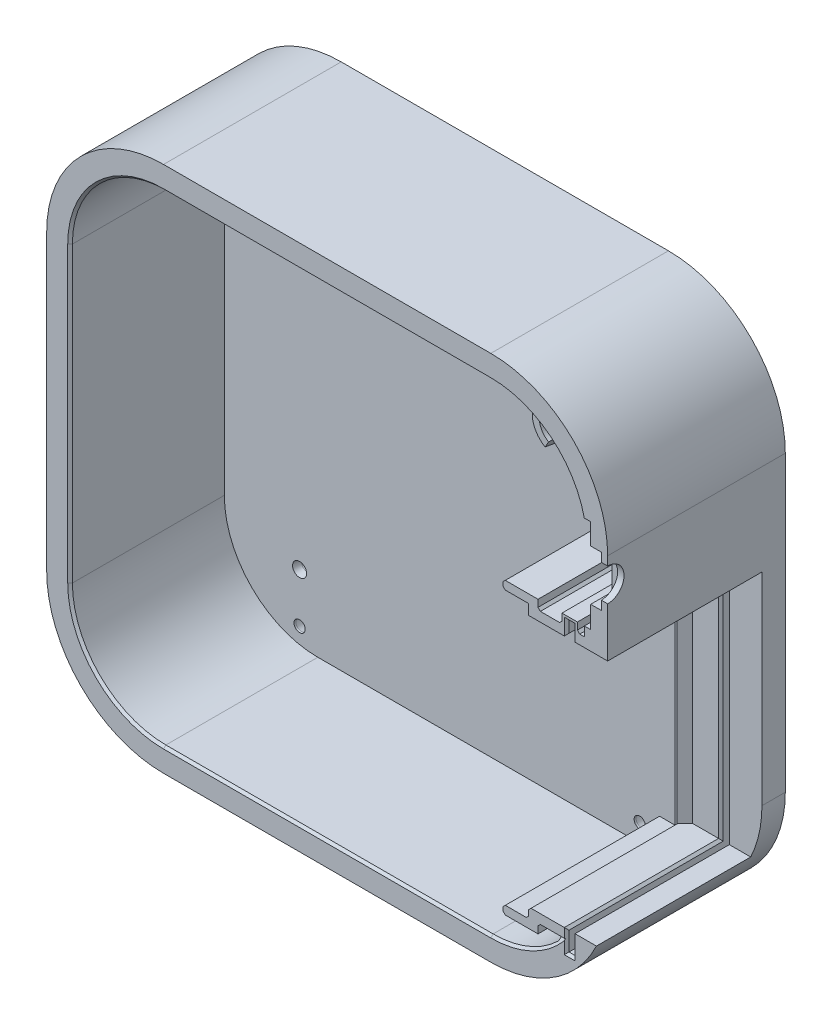
from build123d import *
from build123d.topology import SkipClean

# Parameters (mm, degrees)
SKETCH1_W                = 120
SKETCH1_H                = 120
BOSS_EXTRUDE1_DEPTH      = 5
SKETCH4_W                = 120
SKETCH4_H                = 120
SKETCH4_W_2              = 98.1
SKETCH4_H_2              = 97.5
CUT_EXTRUDE1_DEPTH       = 86
SKETCH9_R                = 1.2
CUT_EXTRUDE2_DEPTH       = 75.102968901
CUT_EXTRUDE4_DEPTH       = 3
SKETCH17_R               = 1.5
SKETCH16_R               = 1.2
SKETCH17_3_R             = 1.5
SKETCH16_3_R             = 1.2
MOVE_FACE2_BY            = 5
MOVE_FACE2_2_BY          = 5
MOVE_FACE3_BY            = 5
MOVE_FACE3_2_BY          = 5
MOVE_FACE4_BY            = 11.9
MOVE_FACE5_BY            = 5.3
FILLET1_R                = 25
SKETCH20_R               = 3
CUT_EXTRUDE5_DEPTH       = 3
CUT_EXTRUDE6_REACH       = 95.2
SKETCH21_R               = 1.2
SKETCH22_R               = 1.5
SKETCH23_R               = 1.2
SKETCH22_3_R             = 1.5
SKETCH23_3_R             = 1.2
SKETCH22_4_R             = 1.5
SKETCH23_4_R             = 1.2
SKETCH22_5_R             = 1.5
SKETCH23_5_R             = 1.2
BOSS_EXTRUDE2_DEPTH      = 33
CUT_EXTRUDE7_REACH       = 100.824
SKETCH31_W               = 9.9
SKETCH31_H               = 2
BOSS_EXTRUDE3_DEPTH      = 33
CUT_EXTRUDE8_REACH       = 100.824
SKETCH35_R               = 5.75
BOSS_EXTRUDE4_START      = 22
BOSS_EXTRUDE4_DEPTH      = 22
SKETCH40_R               = 5.5
SKETCH39_R               = 7.25
SKETCH41_R               = 4
CUT_EXTRUDE9_DEPTH       = 4.5
SKETCH42_R               = 5.75
SKETCH38_R               = 4
CUT_EXTRUDE10_DEPTH      = 4.5
CUT_EXTRUDE11_DEPTH      = 99.824339107
BOSS_EXTRUDE5_REACH      = 105.207
SKETCH49_W               = 11.8
SKETCH49_H               = 10.8
CUT_EXTRUDE12_DEPTH      = 4.6
SKETCH50_R               = 3.5
CUT_EXTRUDE13_DEPTH      = 1.366443
CUT_EXTRUDE14_DEPTH      = 33
CUT_EXTRUDE14_DEPTH_BACK = 2.62
SKETCH51_W               = 1.3
SKETCH51_H               = 61.54
BOSS_EXTRUDE6_DEPTH      = 33
CHAMFER1_SIZE            = 0.5
CHAMFER1_SIZE_2          = 0.353553391
FILLET2_R                = 1


with BuildPart() as part:
    # Sketch1 → Boss-Extrude1 (new body)
    with BuildSketch(Plane.XY):
        Rectangle(SKETCH1_W, SKETCH1_H)
    extrude(amount=BOSS_EXTRUDE1_DEPTH)

    # Sketch4 → Cut-Extrude1 (cut, through all)
    with BuildSketch(Plane.XY.offset(5)):
        Rectangle(SKETCH4_W, SKETCH4_H)
        with Locations((1.45, -5.25)):
            Rectangle(SKETCH4_W_2, SKETCH4_H_2, mode=Mode.SUBTRACT)
    extrude(amount=-CUT_EXTRUDE1_DEPTH, mode=Mode.SUBTRACT)

    # Sketch9 → Cut-Extrude2 (cut, through all)
    with BuildSketch(Plane.XY.offset(5)):
        with Locations((26, 39)):
            Circle(SKETCH9_R)
        with Locations((-31.5, -45)):
            Circle(SKETCH9_R)
    extrude(amount=-CUT_EXTRUDE2_DEPTH, mode=Mode.SUBTRACT)

    # Sketch14 → Cut-Extrude4 (cut)
    with BuildSketch(Plane(origin=(0, 0, 0), x_dir=(-1, 0, 0), z_dir=(0, 0, -1))):
        Polygon((33.1, -47.771281292), (34.7, -45), (33.1, -42.228718708), (29.9, -42.228718708), (28.3, -45), (29.9, -47.771281292), align=None)
        Polygon((-24.4, 36.228718708), (-22.8, 39), (-24.4, 41.771281292), (-27.6, 41.771281292), (-29.2, 39), (-27.6, 36.228718708), align=None)
    extrude(amount=-CUT_EXTRUDE4_DEPTH, mode=Mode.SUBTRACT)

    # Sketch17 → Cut-Loft3 section 0
    with BuildSketch(Plane.XY.offset(5)):
        with Locations((-31.5, -45)):
            Circle(SKETCH17_R)
    # Sketch16 → Cut-Loft3 section 1
    with BuildSketch(Plane.XY.offset(3.4)):
        with Locations((-31.5, -45)):
            Circle(SKETCH16_R)
    loft(mode=Mode.SUBTRACT)

    # Sketch17<3> → Cut-Loft4 section 0
    with BuildSketch(Plane.XY.offset(5)):
        with Locations((26, 39)):
            Circle(SKETCH17_3_R)
    # Sketch16<3> → Cut-Loft4 section 1
    with BuildSketch(Plane.XY.offset(3.4)):
        with Locations((26, 39)):
            Circle(SKETCH16_3_R)
    loft(mode=Mode.SUBTRACT)

    # Move Face2: a face moved outward by 5.0
    extrude(part.faces().sort_by_distance((1.45, -54, 2.5))[0], amount=MOVE_FACE2_BY, dir=(0, -1, 0))

    # Move Face2 2: a face moved outward by 5.0
    extrude(part.faces().sort_by_distance((1.45, 43.5, 2.5))[0], amount=MOVE_FACE2_2_BY, dir=(0, 1, 0))

    # Move Face3: a face moved outward by 5.0
    extrude(part.faces().sort_by_distance((-47.6, -5.25, 2.5))[0], amount=MOVE_FACE3_BY, dir=(-1, 0, 0))

    # Move Face3 2: a face moved outward by 5.0
    extrude(part.faces().sort_by_distance((50.5, -5.25, 2.5))[0], amount=MOVE_FACE3_2_BY, dir=(1, 0, 0))

    # Move Face4: a face moved outward by 11.9
    extrude(part.faces().sort_by_distance((55.5, -5.25, 2.5))[0], amount=MOVE_FACE4_BY, dir=(1, 0, 0))

    # Move Face5: a face moved outward by 5.3
    extrude(part.faces().sort_by_distance((7.4, -59, 2.5))[0], amount=MOVE_FACE5_BY, dir=(0, -1, 0))

    # Fillet1
    fillet1_edges = [part.edges().sort_by_distance(p)[0] for p in [
        (-52.6, 48.5, 2.5),
        (67.4, 48.5, 2.5),
        (67.4, -64.3, 2.5),
        (-52.6, -64.3, 2.5),
    ]]
    fillet(fillet1_edges, radius=FILLET1_R)

    # Sketch20 → Cut-Extrude5 (cut)
    with BuildSketch(Plane(origin=(0, 0, 0), x_dir=(-1, 0, 0), z_dir=(0, 0, -1))):
        with Locations((31.5, -55.482921978)):
            Circle(SKETCH20_R)
        with Locations((31.5, 39)):
            Circle(SKETCH20_R)
        with Locations((-41.264969929, 39)):
            Circle(SKETCH20_R)
        with Locations((-41.264969929, -55.482921978)):
            Circle(SKETCH20_R)
    extrude(amount=-CUT_EXTRUDE5_DEPTH, mode=Mode.SUBTRACT)

    # Sketch21 → Cut-Extrude6 (cut, up to next)
    with BuildSketch(Plane(origin=(0, 0, 3), x_dir=(-1, 0, 0), z_dir=(0, 0, -1)), mode=Mode.PRIVATE) as cut_extrude6_sk1:
        with Locations((-41.264969929, -55.482921978)):
            Circle(SKETCH21_R)
    cut_extrude6_tool1 = extrude(cut_extrude6_sk1.sketch, amount=-CUT_EXTRUDE6_REACH, mode=Mode.PRIVATE) & part.part
    # Sketch21 → Cut-Extrude6 (cut, up to next)
    with BuildSketch(Plane(origin=(0, 0, 3), x_dir=(-1, 0, 0), z_dir=(0, 0, -1)), mode=Mode.PRIVATE) as cut_extrude6_sk2:
        with Locations((31.5, -55.482921978)):
            Circle(SKETCH21_R)
    cut_extrude6_tool2 = extrude(cut_extrude6_sk2.sketch, amount=-CUT_EXTRUDE6_REACH, mode=Mode.PRIVATE) & part.part
    # Sketch21 → Cut-Extrude6 (cut, up to next)
    with BuildSketch(Plane(origin=(0, 0, 3), x_dir=(-1, 0, 0), z_dir=(0, 0, -1)), mode=Mode.PRIVATE) as cut_extrude6_sk3:
        with Locations((31.5, 39)):
            Circle(SKETCH21_R)
    cut_extrude6_tool3 = extrude(cut_extrude6_sk3.sketch, amount=-CUT_EXTRUDE6_REACH, mode=Mode.PRIVATE) & part.part
    # Sketch21 → Cut-Extrude6 (cut, up to next)
    with BuildSketch(Plane(origin=(0, 0, 3), x_dir=(-1, 0, 0), z_dir=(0, 0, -1)), mode=Mode.PRIVATE) as cut_extrude6_sk4:
        with Locations((-41.264969929, 39)):
            Circle(SKETCH21_R)
    cut_extrude6_tool4 = extrude(cut_extrude6_sk4.sketch, amount=-CUT_EXTRUDE6_REACH, mode=Mode.PRIVATE) & part.part
    add(cut_extrude6_tool1.solids().sort_by_distance((41.26497, -55.482922, 3))[0], mode=Mode.SUBTRACT)
    add(cut_extrude6_tool2.solids().sort_by_distance((-31.5, -55.482922, 3))[0], mode=Mode.SUBTRACT)
    add(cut_extrude6_tool3.solids().sort_by_distance((-31.5, 39, 3))[0], mode=Mode.SUBTRACT)
    add(cut_extrude6_tool4.solids().sort_by_distance((41.26497, 39, 3))[0], mode=Mode.SUBTRACT)

    # Sketch22 → Cut-Loft5 section 0
    with BuildSketch(Plane(origin=(0, 0, 3), x_dir=(-1, 0, 0), z_dir=(0, 0, -1))):
        with Locations((-41.264969929, 39)):
            Circle(SKETCH22_R)
    # Sketch23 → Cut-Loft5 section 1
    with BuildSketch(Plane(origin=(0, 0, 4.6), x_dir=(-1, 0, 0), z_dir=(0, 0, -1))):
        with Locations((-41.264969929, 39)):
            Circle(SKETCH23_R)
    loft(mode=Mode.SUBTRACT)

    # Sketch22<3> → Cut-Loft6 section 0
    with BuildSketch(Plane(origin=(0, 0, 3), x_dir=(-1, 0, 0), z_dir=(0, 0, -1))):
        with Locations((31.5, 39)):
            Circle(SKETCH22_3_R)
    # Sketch23<3> → Cut-Loft6 section 1
    with BuildSketch(Plane(origin=(0, 0, 4.6), x_dir=(-1, 0, 0), z_dir=(0, 0, -1))):
        with Locations((31.5, 39)):
            Circle(SKETCH23_3_R)
    loft(mode=Mode.SUBTRACT)

    # Sketch22<4> → Cut-Loft7 section 0
    with BuildSketch(Plane(origin=(0, 0, 3), x_dir=(-1, 0, 0), z_dir=(0, 0, -1))):
        with Locations((31.5, -55.482921978)):
            Circle(SKETCH22_4_R)
    # Sketch23<4> → Cut-Loft7 section 1
    with BuildSketch(Plane(origin=(0, 0, 4.6), x_dir=(-1, 0, 0), z_dir=(0, 0, -1))):
        with Locations((31.5, -55.482921978)):
            Circle(SKETCH23_4_R)
    loft(mode=Mode.SUBTRACT)

    # Sketch22<5> → Cut-Loft8 section 0
    with BuildSketch(Plane(origin=(0, 0, 3), x_dir=(-1, 0, 0), z_dir=(0, 0, -1))):
        with Locations((-41.264969929, -55.482921978)):
            Circle(SKETCH22_5_R)
    # Sketch23<5> → Cut-Loft8 section 1
    with BuildSketch(Plane(origin=(0, 0, 4.6), x_dir=(-1, 0, 0), z_dir=(0, 0, -1))):
        with Locations((-41.264969929, -55.482921978)):
            Circle(SKETCH23_5_R)
    loft(mode=Mode.SUBTRACT)

    # Sketch24 → Boss-Extrude2 (add)
    with BuildSketch(Plane.XY.offset(5)):
        with BuildLine():
            Line((-27.6, -64.3), (42.4, -64.3))
            ThreePointArc((42.4, -64.3), (60.07766953, -56.97766953), (67.4, -39.3))
            Line((67.4, -39.3), (67.4, 23.5))
            ThreePointArc((67.4, 23.5), (60.07766953, 41.17766953), (42.4, 48.5))
            Line((42.4, 48.5), (-27.6, 48.5))
            ThreePointArc((-27.6, 48.5), (-45.27766953, 41.17766953), (-52.6, 23.5))
            Line((-52.6, 23.5), (-52.6, -39.3))
            ThreePointArc((-52.6, -39.3), (-45.27766953, -56.97766953), (-27.6, -64.3))
        make_face()
        with BuildLine():
            Line((-27.6, -59.3), (42.4, -59.3))
            ThreePointArc((42.4, -59.3), (56.542135624, -53.442135624), (62.4, -39.3))
            Line((62.4, -39.3), (62.4, 23.5))
            ThreePointArc((62.4, 23.5), (56.542135624, 37.642135624), (42.4, 43.5))
            Line((42.4, 43.5), (-27.6, 43.5))
            ThreePointArc((-27.6, 43.5), (-41.742135624, 37.642135624), (-47.6, 23.5))
            Line((-47.6, 23.5), (-47.6, -39.3))
            ThreePointArc((-47.6, -39.3), (-41.742135624, -53.442135624), (-27.6, -59.3))
        make_face(mode=Mode.SUBTRACT)
    extrude(amount=BOSS_EXTRUDE2_DEPTH)

    # Sketch32 → Cut-Extrude7 (cut, up to next)
    with BuildSketch(Plane.XY.offset(5), mode=Mode.PRIVATE) as cut_extrude7_sk1:
        with BuildLine():
            Line((63.769551832, 28), (61.88717527, 28))
            ThreePointArc((61.88717527, 28), (62.271380241, 25.76456338), (62.4, 23.5))
            Line((62.4, 23.5), (62.4, 8))
            Line((62.4, 8), (63.769551832, 8))
            Line((63.769551832, 8), (63.769551832, 28))
        make_face()
    cut_extrude7_tool1 = extrude(cut_extrude7_sk1.sketch, amount=CUT_EXTRUDE7_REACH, mode=Mode.PRIVATE) & part.part
    add(cut_extrude7_tool1.solids().sort_by_distance((63.061993, 18.241289, 5))[0], mode=Mode.SUBTRACT)

    # Sketch31 → Boss-Extrude3 (add)
    with BuildSketch(Plane.XY.offset(5)):
        Polygon((50.5, -52.2), (45, -52.2), (45, -54), (52.5, -54), (52.5, -50), (50.5, -50), align=None)
        with BuildLine():
            ThreePointArc((57.850242717, -52), (58.604526947, -51.022342191), (59.297041161, -50))
            Line((59.297041161, -50), (52.5, -50))
            Line((52.5, -50), (52.5, -52))
            Line((52.5, -52), (57.850242717, -52))
        make_face()
        with Locations((57.45, 5)):
            Rectangle(SKETCH31_W, SKETCH31_H)
        Polygon((52.5, 4), (52.5, 8), (45, 8), (45, 6.2), (50.5, 6.2), (50.5, 4), align=None)
    extrude(amount=BOSS_EXTRUDE3_DEPTH)

    # Sketch35 → Cut-Extrude8 (cut, up to next)
    with BuildSketch(Plane.XY.offset(5), mode=Mode.PRIVATE) as cut_extrude8_sk1:
        with Locations((50.266574284, 35.232977006)):
            Circle(SKETCH35_R)
    cut_extrude8_tool1 = extrude(cut_extrude8_sk1.sketch, amount=-CUT_EXTRUDE8_REACH, mode=Mode.PRIVATE) & part.part
    add(cut_extrude8_tool1.solids().sort_by_distance((50.266574, 35.232977, 5))[0], mode=Mode.SUBTRACT)

    # Sketch34 → Boss-Extrude4 (add)
    with SkipClean():  # the faces are left unmerged after this step: merging them gives an invalid solid
        with BuildSketch(Plane.XY.offset(5).offset(BOSS_EXTRUDE4_START)):
            with BuildLine():
                ThreePointArc((47.391574284, 30.253330935), (45.220371458, 32.476468883), (44.522997779, 35.504691796))
                Line((44.522997779, 35.504691796), (43.024673473, 35.575573915))
                ThreePointArc((43.024673473, 35.575573915), (43.90397072, 31.757379808), (46.641574284, 28.954292829))
                Line((46.641574284, 28.954292829), (46.65847923, 28.983573053))
                Line((46.65847923, 28.983573053), (47.391574284, 30.253330935))
            make_face()
            with BuildLine():
                Line((47.516512998, 41.941155814), (48.085491195, 40.553256751))
                ThreePointArc((48.085491195, 40.553256751), (53.469797055, 40.008106731), (56.016574284, 35.232977006))
                ThreePointArc((56.016574284, 35.232977006), (55.246220356, 32.357977006), (53.141574284, 30.253330935))
                Line((53.141574284, 30.253330935), (53.891574284, 28.954292829))
                ThreePointArc((53.891574284, 28.954292829), (56.899565019, 32.306215328), (57.347944703, 36.787548652))
                ThreePointArc((57.347944703, 36.787548652), (53.537671718, 40.11181112), (49.015453665, 42.374209197))
                ThreePointArc((49.015453665, 42.374209197), (48.254299957, 42.19812252), (47.516512998, 41.941155814))
            make_face()
        extrude(amount=-BOSS_EXTRUDE4_DEPTH)

    # Sketch45 → Cut-Extrude11 (cut, through all)
    with SkipClean():  # the faces are left unmerged after this step: merging them gives an invalid solid
        with BuildSketch(Plane.XY.offset(5)):
            with BuildLine():
                Line((62.4, 4), (62.4, -39.3))
                ThreePointArc((62.4, -39.3), (61.608602542, -44.870420845), (59.297041161, -50))
                Line((59.297041161, -50), (64.99446835, -50))
                ThreePointArc((64.99446835, -50), (66.791204447, -44.783534046), (67.4, -39.3))
                Line((67.4, -39.3), (67.4, 4))
                Line((67.4, 4), (62.4, 4))
            make_face()
        extrude(amount=CUT_EXTRUDE11_DEPTH, mode=Mode.SUBTRACT)

    # Sketch46 → Boss-Extrude5 (add, up to next)
    with BuildSketch(Plane.XZ.offset(-4), mode=Mode.PRIVATE) as boss_extrude5_sk1:
        Polygon((50.5, 5), (50.5, 7), (52.5, 5), align=None)
    boss_extrude5_tool1 = extrude(boss_extrude5_sk1.sketch, amount=BOSS_EXTRUDE5_REACH, mode=Mode.PRIVATE) - part.part
    add(boss_extrude5_tool1.solids().sort_by_distance((51.166667, 4, 5.666667))[0])

    # Sketch49 → Cut-Extrude12 (cut)
    with SkipClean():  # the faces are left unmerged after this step: merging them gives an invalid solid
        with BuildSketch(Plane.XY.offset(38)):
            with Locations((60.133557108, 18.1)):
                Rectangle(SKETCH49_W, SKETCH49_H)
        extrude(amount=-CUT_EXTRUDE12_DEPTH, mode=Mode.SUBTRACT)

    # Sketch50 → Cut-Extrude13 (cut)
    with SkipClean():  # the faces are left unmerged after this step: merging them gives an invalid solid
        with BuildSketch(Plane.ZY.offset(-66.033557108)):
            with Locations((38, 18.1)):
                Circle(SKETCH50_R)
        extrude(amount=-CUT_EXTRUDE13_DEPTH, mode=Mode.SUBTRACT)

    # Sketch51 → Cut-Extrude14 (cut, two sides: drawn at the far end of the back side and taken through both)
    with SkipClean():  # the faces are left unmerged after this step: merging them gives an invalid solid
        with BuildSketch(Plane.XY.offset(5).offset(-CUT_EXTRUDE14_DEPTH_BACK)):
            with Locations((59.274136893, -23.77)):
                Rectangle(SKETCH51_W, SKETCH51_H)
        extrude(amount=CUT_EXTRUDE14_DEPTH + CUT_EXTRUDE14_DEPTH_BACK, mode=Mode.SUBTRACT)

    # Sketch52 → Boss-Extrude6 (add)
    with SkipClean():  # the faces are left unmerged after this step: merging them gives an invalid solid
        with BuildSketch(Plane.XY.offset(5)):
            Polygon((59.924136893, 7), (59.924136893, 6), (60.924136893, 6), (60.924136893, 8), (57.624136893, 8), (57.624136893, 6), (58.624136893, 6), (58.624136893, 7), align=None)
        extrude(amount=BOSS_EXTRUDE6_DEPTH)

    # Chamfer1
    # the kernel refuses this chamfer: 0.5, 0.353553391 mm, written as the material it adds along each edge
    with BuildSketch(Plane(origin=(50.5, -52.2, 3.714158506), x_dir=(0.02749587661058229, 0.9996219169112968, 0), z_dir=(0, 0, 1)), Plane(origin=(52.5, -52, 3.714158506), x_dir=(-0.02749587661058229, -0.9996219169112968, 0), z_dir=(0, 0, 1)), Plane(origin=(52.5, 6, 3.714158506), x_dir=(0.9996219169112968, -0.02749587661058574, 0), z_dir=(0, 0, 1)), Plane(origin=(60.924136893, 6, 3.714158506), x_dir=(0.9996219169112968, -0.02749587661058574, 0), z_dir=(0, 0, 1)), Plane(origin=(57.624136893, 6, 3.714158506), x_dir=(0.0274958766105822, 0.999621916911297, 0), z_dir=(0, 0, 1))) as chamfer1_piece_1:
        Polygon((CHAMFER1_SIZE * 0.999621916911, CHAMFER1_SIZE * 0.0274958766106), (-CHAMFER1_SIZE * 0.0274958766106, CHAMFER1_SIZE * 0.999621916911), (0, 0), align=None)
    extrude(amount=34.285841494)
    # the kernel refuses this chamfer: 0.5, 0.353553391 mm, written as the material it takes off along each edge
    with BuildSketch(Plane(origin=(-27.6, -39.3, 38), x_dir=(-1, 0, 0), z_dir=(0, 1, 0))) as chamfer1_2_piece_1:
        Polygon((20, -CHAMFER1_SIZE), (20 + CHAMFER1_SIZE, 0), (20, 0), align=None)
    revolve(axis=Axis((-27.6, -39.3, 38), (0, 0, 1)), revolution_arc=90, mode=Mode.SUBTRACT)
    with BuildSketch(Plane(origin=(-27.6, -59.3, 38), x_dir=(0, 0.02749587661058229, -0.9996219169112968), z_dir=(1, 0, 0)), Plane(origin=(42.4, 43.5, 38), x_dir=(0, -0.02749587661058229, -0.9996219169112968), z_dir=(-1, 0, 0))) as chamfer1_2_piece_2:
        Polygon((CHAMFER1_SIZE * 0.999621916911, -CHAMFER1_SIZE * 0.0274958766106), (-CHAMFER1_SIZE * 0.0274958766106, -CHAMFER1_SIZE * 0.999621916911), (0, 0), align=None)
    extrude(amount=70, mode=Mode.SUBTRACT)
    with BuildSketch(Plane(origin=(42.4, -39.3, 38), x_dir=(0, -1, 0), z_dir=(-1, 0, 0))) as chamfer1_2_piece_3_section:
        Polygon((20, -CHAMFER1_SIZE), (20 + CHAMFER1_SIZE, 0), (20, 0), align=None)
    chamfer1_2_piece_3 = revolve(axis=Axis((42.4, -39.3, 38), (0, 0, 1)), revolution_arc=54.264147352, mode=Mode.PRIVATE)
    chamfer1_2_piece_3 = split(chamfer1_2_piece_3, bisect_by=Plane(origin=(51.233219772, -52, 37.759554812), z_dir=(0, -1, 0)), keep=Keep.TOP, mode=Mode.PRIVATE)
    add(chamfer1_2_piece_3, mode=Mode.SUBTRACT)
    with BuildSketch(Plane(origin=(-27.6, 23.5, 38), x_dir=(0, 1, 0), z_dir=(1, 0, 0))) as chamfer1_2_piece_4:
        Polygon((20, -CHAMFER1_SIZE), (20 + CHAMFER1_SIZE, 0), (20, 0), align=None)
    revolve(axis=Axis((-27.6, 23.5, 38), (0, 0, 1)), revolution_arc=90, mode=Mode.SUBTRACT)
    with BuildSketch(Plane(origin=(-47.6, 23.5, 38), x_dir=(0.02749587661058229, 0, -0.9996219169112968), z_dir=(0, -1, 0))) as chamfer1_2_piece_5:
        Polygon((CHAMFER1_SIZE * 0.999621916911, -CHAMFER1_SIZE * 0.0274958766106), (-CHAMFER1_SIZE * 0.0274958766106, -CHAMFER1_SIZE * 0.999621916911), (0, 0), align=None)
    extrude(amount=62.8, mode=Mode.SUBTRACT)
    with BuildSketch(Plane(origin=(42.4, 23.5, 38), x_dir=(0.9868045291807881, 0.16191609304909516, 0), z_dir=(0.16191609304909516, -0.9868045291807881, 0))) as chamfer1_2_piece_6:
        Polygon((20, -CHAMFER1_SIZE), (20 + CHAMFER1_SIZE, 0), (20, 0), align=None)
    revolve(axis=Axis((42.4, 23.5, 38), (0, 0, 1)), revolution_arc=80.681869357, mode=Mode.SUBTRACT)
    with BuildSketch(Plane(origin=(45, -52.2, 5), x_dir=(0.999621916911297, 0.027495876610582292, 0), z_dir=(0, 0, 1)), Plane(origin=(45, -54, 5), x_dir=(-0.02749587661058229, 0.9996219169112968, 0), z_dir=(0, 0, 1)), Plane(origin=(45, 8, 5), x_dir=(0.9996219169112968, 0.02749587661058574, 0), z_dir=(0, 0, 1)), Plane(origin=(45, 6.2, 5), x_dir=(-0.0274958766105822, 0.999621916911297, 0), z_dir=(0, 0, 1)), Plane(origin=(58.624136893, -50, 39.285841494), x_dir=(-0.999621916911297, 0.027495876610582292, 0), z_dir=(0, 0, -1)), Plane(origin=(58.624136893, 4, 5), x_dir=(-0.9996219169112968, -0.027495876610584877, 0), z_dir=(0, 0, 1)), Plane(origin=(59.924136893, -50, 39.285841494), x_dir=(-0.02749587661058229, -0.9996219169112968, 0), z_dir=(0, 0, -1))) as chamfer1_2_piece_7:
        Polygon((CHAMFER1_SIZE * 0.999621916911, -CHAMFER1_SIZE * 0.0274958766106), (-CHAMFER1_SIZE * 0.0274958766106, -CHAMFER1_SIZE * 0.999621916911), (0, 0), align=None)
    extrude(amount=34.285841494, mode=Mode.SUBTRACT)
    with BuildSketch(Plane(origin=(50.5, -50, 5.714158506), x_dir=(-0.02749587661058229, -0.9996219169112968, 0), z_dir=(0, 0, 1))) as chamfer1_2_piece_8_section:
        Polygon((CHAMFER1_SIZE * 0.999621916911, CHAMFER1_SIZE * 0.0274958766106), (-CHAMFER1_SIZE * 0.0274958766106, CHAMFER1_SIZE * 0.999621916911), (0, 0), align=None)
    chamfer1_2_piece_8 = extrude(amount=33.571682988, mode=Mode.PRIVATE)
    chamfer1_2_piece_8 = split(chamfer1_2_piece_8, bisect_by=Plane(origin=(42.552579154, -50.164635273, 14.947420846), z_dir=(0.7071067811865462, 0, 0.7071067811865488)), keep=Keep.TOP, mode=Mode.PRIVATE)
    add(chamfer1_2_piece_8, mode=Mode.SUBTRACT)
    with BuildSketch(Plane(origin=(58.624136893, 4, 5), x_dir=(0.0274958766105822, 0, -0.999621916911297), z_dir=(0, -1, 0))) as chamfer1_2_piece_9:
        Polygon((CHAMFER1_SIZE * 0.999621916911, -CHAMFER1_SIZE * 0.0274958766106), (-CHAMFER1_SIZE * 0.0274958766106, -CHAMFER1_SIZE * 0.999621916911), (0, 0), align=None)
    extrude(amount=54, mode=Mode.SUBTRACT)
    with BuildSketch(Plane(origin=(59.924136893, -48.938704589, 5), x_dir=(-0.02749587661056834, 0, -0.9996219169112972), z_dir=(0, 1, 0))) as chamfer1_2_piece_10:
        Polygon((CHAMFER1_SIZE * 0.999621916911, -CHAMFER1_SIZE * 0.0274958766106), (-CHAMFER1_SIZE * 0.0274958766106, -CHAMFER1_SIZE * 0.999621916911), (0, 0), align=None)
    extrude(amount=52.938704589, mode=Mode.SUBTRACT)
    with BuildSketch(Plane(origin=(59.924136893, -48.714158506, 38), x_dir=(0.999621916911297, 0, 0.027495876610582292), z_dir=(0, -1, 0)), Plane(origin=(58.624136893, -54.54, 38), x_dir=(-0.999621916911297, 0, 0.027495876610582292), z_dir=(0, 1, 0))) as chamfer1_2_piece_11:
        Polygon((CHAMFER1_SIZE * 0.999621916911, -CHAMFER1_SIZE * 0.0274958766106), (-CHAMFER1_SIZE * 0.0274958766106, -CHAMFER1_SIZE * 0.999621916911), (0, 0), align=None)
    extrude(amount=5.825841494, mode=Mode.SUBTRACT)
    with BuildSketch(Plane(origin=(59.924136893, -54.54, 38), x_dir=(0, -0.999621916911297, 0.027495876610582292), z_dir=(-1, 0, 0)), Plane(origin=(58.624136893, 7, 38), x_dir=(0, 0.999621916911297, 0.0274958766105822), z_dir=(1, 0, 0))) as chamfer1_2_piece_12:
        Polygon((CHAMFER1_SIZE * 0.999621916911, -CHAMFER1_SIZE * 0.0274958766106), (-CHAMFER1_SIZE * 0.0274958766106, -CHAMFER1_SIZE * 0.999621916911), (0, 0), align=None)
    extrude(amount=1.3, mode=Mode.SUBTRACT)
    with BuildSketch(Plane(origin=(58.624136893, 2.714158506, 38), x_dir=(-0.999621916911297, 0, 0.027495876610582292), z_dir=(0, 1, 0)), Plane(origin=(59.924136893, 6, 38), x_dir=(0.999621916911297, 0, 0.027495876610582292), z_dir=(0, -1, 0))) as chamfer1_2_piece_13:
        Polygon((CHAMFER1_SIZE * 0.999621916911, -CHAMFER1_SIZE * 0.0274958766106), (-CHAMFER1_SIZE * 0.0274958766106, -CHAMFER1_SIZE * 0.999621916911), (0, 0), align=None)
    extrude(amount=3.285841494, mode=Mode.SUBTRACT)
    with BuildSketch(Plane(origin=(59.924136893, 4, 39.285841494), x_dir=(-0.0274958766105822, 0.999621916911297, 0), z_dir=(0, 0, -1))) as chamfer1_2_piece_14:
        Polygon((CHAMFER1_SIZE * 0.999621916911, CHAMFER1_SIZE * 0.0274958766106), (-CHAMFER1_SIZE * 0.0274958766106, CHAMFER1_SIZE * 0.999621916911), (0, 0), align=None)
    extrude(amount=34.285841494, mode=Mode.SUBTRACT)
    with BuildSketch(Plane(origin=(50.5, 4, 7), x_dir=(-0.05647824947249913, 0, -0.9984038297885892), z_dir=(0, -1, 0))) as chamfer1_2_piece_15:
        Polygon((CHAMFER1_SIZE_2 * 0.99840382864, CHAMFER1_SIZE_2 * 0.0564782494075), (CHAMFER1_SIZE * 0.666041965215, CHAMFER1_SIZE * 0.745914271598), (0, 0), align=None)
    extrude(amount=54, mode=Mode.SUBTRACT)
    with BuildSketch(Plane(origin=(59.924136893, 7, 38), x_dir=(0.999621916911297, 0, 0.027495876610582292), z_dir=(0, -1, 0)), Plane(origin=(58.624136893, 6, 38), x_dir=(-0.999621916911297, 0, 0.027495876610582292), z_dir=(0, 1, 0))) as chamfer1_2_piece_16:
        Polygon((CHAMFER1_SIZE * 0.999621916911, -CHAMFER1_SIZE * 0.0274958766106), (-CHAMFER1_SIZE * 0.0274958766106, -CHAMFER1_SIZE * 0.999621916911), (0, 0), align=None)
    extrude(amount=1, mode=Mode.SUBTRACT)
    with BuildSketch(Plane(origin=(59.924136893, -50, 5), x_dir=(-0.0274958766105822, 0, -0.999621916911297), z_dir=(0, 1, 0))) as chamfer1_2_piece_17:
        Polygon((CHAMFER1_SIZE * 0.999621916911, -CHAMFER1_SIZE * 0.0274958766106), (-CHAMFER1_SIZE * 0.0274958766106, -CHAMFER1_SIZE * 0.999621916911), (0, 0), align=None)
    extrude(amount=1.061295411, mode=Mode.SUBTRACT)
    with BuildSketch(Plane(origin=(50.5, 4, 7), x_dir=(-0.05647824947249913, 0, -0.9984038297885892), z_dir=(0, -1, 0))) as chamfer1_2_piece_18a_section:
        Polygon((CHAMFER1_SIZE_2 * 0.99840382864, CHAMFER1_SIZE_2 * 0.0564782494075), (CHAMFER1_SIZE * 0.666041965215, CHAMFER1_SIZE * 0.745914271598), (0, 0), align=None)
    chamfer1_2_piece_18a = extrude(amount=55.285841494, mode=Mode.PRIVATE)
    chamfer1_2_piece_18a = split(chamfer1_2_piece_18a, bisect_by=Plane(origin=(50.618325477, -50, 6.76762343), z_dir=(0, -1, 0)), keep=Keep.TOP, mode=Mode.PRIVATE)
    with BuildSketch(Plane(origin=(50.5, -50, 5.714158506), x_dir=(-0.02749587661058229, -0.9996219169112968, 0), z_dir=(0, 0, 1))) as chamfer1_2_piece_18b_section:
        Polygon((CHAMFER1_SIZE * 0.999621916911, CHAMFER1_SIZE * 0.0274958766106), (-CHAMFER1_SIZE * 0.0274958766106, CHAMFER1_SIZE * 0.999621916911), (0, 0), align=None)
    chamfer1_2_piece_18b = extrude(amount=33.571682988, mode=Mode.PRIVATE)
    chamfer1_2_piece_18b = split(chamfer1_2_piece_18b, bisect_by=Plane(origin=(50.934510937, -50.172468269, 6.565489063), z_dir=(-0.7071067811865462, 0, -0.7071067811865488)), keep=Keep.TOP, mode=Mode.PRIVATE)
    chamfer1_2_piece_18 = chamfer1_2_piece_18a & chamfer1_2_piece_18b
    add(chamfer1_2_piece_18, mode=Mode.SUBTRACT)
    with BuildSketch(Plane(origin=(58.624136893, 4, 3.714158506), x_dir=(-0.9996219169112968, -0.027495876610586605, 0), z_dir=(0, 0, 1))) as chamfer1_2_piece_19a_section:
        Polygon((CHAMFER1_SIZE * 0.999621916911, -CHAMFER1_SIZE * 0.0274958766106), (-CHAMFER1_SIZE * 0.0274958766106, -CHAMFER1_SIZE * 0.999621916911), (0, 0), align=None)
    chamfer1_2_piece_19a = extrude(amount=35.571682988, mode=Mode.PRIVATE)
    chamfer1_2_piece_19a = split(chamfer1_2_piece_19a, bisect_by=Plane(origin=(58.45924008, 4.164896813, 5), z_dir=(0, 0, -1)), keep=Keep.TOP, mode=Mode.PRIVATE)
    with BuildSketch(Plane(origin=(58.624136893, 5.285841494, 5), x_dir=(0.0274958766105822, 0, -0.999621916911297), z_dir=(0, -1, 0))) as chamfer1_2_piece_19b_section:
        Polygon((CHAMFER1_SIZE * 0.999621916911, -CHAMFER1_SIZE * 0.0274958766106), (-CHAMFER1_SIZE * 0.0274958766106, -CHAMFER1_SIZE * 0.999621916911), (0, 0), align=None)
    chamfer1_2_piece_19b = extrude(amount=55.285841494, mode=Mode.PRIVATE)
    chamfer1_2_piece_19b = split(chamfer1_2_piece_19b, bisect_by=Plane(origin=(58.45924008, 4, 4.835103187), z_dir=(0, 1, 0)), keep=Keep.TOP, mode=Mode.PRIVATE)
    chamfer1_2_piece_19 = chamfer1_2_piece_19a & chamfer1_2_piece_19b
    add(chamfer1_2_piece_19, mode=Mode.SUBTRACT)
    with BuildSketch(Plane(origin=(58.624136893, -50, 39.285841494), x_dir=(-0.999621916911297, 0.027495876610582292, 0), z_dir=(0, 0, -1))) as chamfer1_2_piece_20a_section:
        Polygon((CHAMFER1_SIZE * 0.999621916911, -CHAMFER1_SIZE * 0.0274958766106), (-CHAMFER1_SIZE * 0.0274958766106, -CHAMFER1_SIZE * 0.999621916911), (0, 0), align=None)
    chamfer1_2_piece_20a = extrude(amount=35.571682988, mode=Mode.PRIVATE)
    chamfer1_2_piece_20a = split(chamfer1_2_piece_20a, bisect_by=Plane(origin=(58.45924008, -50.164896813, 5), z_dir=(0, 0, -1)), keep=Keep.TOP, mode=Mode.PRIVATE)
    with BuildSketch(Plane(origin=(58.624136893, 4, 5), x_dir=(0.0274958766105822, 0, -0.999621916911297), z_dir=(0, -1, 0))) as chamfer1_2_piece_20b_section:
        Polygon((CHAMFER1_SIZE * 0.999621916911, -CHAMFER1_SIZE * 0.0274958766106), (-CHAMFER1_SIZE * 0.0274958766106, -CHAMFER1_SIZE * 0.999621916911), (0, 0), align=None)
    chamfer1_2_piece_20b = extrude(amount=55.285841494, mode=Mode.PRIVATE)
    chamfer1_2_piece_20b = split(chamfer1_2_piece_20b, bisect_by=Plane(origin=(58.45924008, -50, 4.835103187), z_dir=(0, -1, 0)), keep=Keep.TOP, mode=Mode.PRIVATE)
    chamfer1_2_piece_20 = chamfer1_2_piece_20a & chamfer1_2_piece_20b
    add(chamfer1_2_piece_20, mode=Mode.SUBTRACT)
    with BuildSketch(Plane(origin=(59.924136893, -48.938704589, 5), x_dir=(-0.02749587661056834, 0, -0.9996219169112972), z_dir=(0, 1, 0))) as chamfer1_2_piece_21a_section:
        Polygon((CHAMFER1_SIZE * 0.999621916911, -CHAMFER1_SIZE * 0.0274958766106), (-CHAMFER1_SIZE * 0.0274958766106, -CHAMFER1_SIZE * 0.999621916911), (0, 0), align=None)
    chamfer1_2_piece_21a = extrude(amount=54.224546083, mode=Mode.PRIVATE)
    chamfer1_2_piece_21a = split(chamfer1_2_piece_21a, bisect_by=Plane(origin=(60.089033707, 4, 4.835103187), z_dir=(0, 1, 0)), keep=Keep.TOP, mode=Mode.PRIVATE)
    with BuildSketch(Plane(origin=(59.924136893, 4, 39.285841494), x_dir=(-0.0274958766105822, 0.999621916911297, 0), z_dir=(0, 0, -1))) as chamfer1_2_piece_21b_section:
        Polygon((CHAMFER1_SIZE * 0.999621916911, CHAMFER1_SIZE * 0.0274958766106), (-CHAMFER1_SIZE * 0.0274958766106, CHAMFER1_SIZE * 0.999621916911), (0, 0), align=None)
    chamfer1_2_piece_21b = extrude(amount=35.571682988, mode=Mode.PRIVATE)
    chamfer1_2_piece_21b = split(chamfer1_2_piece_21b, bisect_by=Plane(origin=(60.089033707, 4.164896813, 5), z_dir=(0, 0, -1)), keep=Keep.TOP, mode=Mode.PRIVATE)
    chamfer1_2_piece_21 = chamfer1_2_piece_21a & chamfer1_2_piece_21b
    add(chamfer1_2_piece_21, mode=Mode.SUBTRACT)
    with BuildSketch(Plane(origin=(61.209978387, -54.54, 38), x_dir=(0, -0.999621916911297, 0.027495876610582292), z_dir=(-1, 0, 0))) as chamfer1_2_piece_22a_section:
        Polygon((CHAMFER1_SIZE * 0.999621916911, -CHAMFER1_SIZE * 0.0274958766106), (-CHAMFER1_SIZE * 0.0274958766106, -CHAMFER1_SIZE * 0.999621916911), (0, 0), align=None)
    chamfer1_2_piece_22a = extrude(amount=2.585841494, mode=Mode.PRIVATE)
    chamfer1_2_piece_22a = split(chamfer1_2_piece_22a, bisect_by=Plane(origin=(59.924136893, -54.704896813, 37.835103187), z_dir=(1, 0, 0)), keep=Keep.TOP, mode=Mode.PRIVATE)
    with BuildSketch(Plane(origin=(59.924136893, -48.714158506, 38), x_dir=(0.999621916911297, 0, 0.027495876610582292), z_dir=(0, -1, 0))) as chamfer1_2_piece_22b_section:
        Polygon((CHAMFER1_SIZE * 0.999621916911, -CHAMFER1_SIZE * 0.0274958766106), (-CHAMFER1_SIZE * 0.0274958766106, -CHAMFER1_SIZE * 0.999621916911), (0, 0), align=None)
    chamfer1_2_piece_22b = extrude(amount=7.111682988, mode=Mode.PRIVATE)
    chamfer1_2_piece_22b = split(chamfer1_2_piece_22b, bisect_by=Plane(origin=(60.089033707, -54.54, 37.835103187), z_dir=(0, -1, 0)), keep=Keep.TOP, mode=Mode.PRIVATE)
    chamfer1_2_piece_22 = chamfer1_2_piece_22a & chamfer1_2_piece_22b
    add(chamfer1_2_piece_22, mode=Mode.SUBTRACT)
    with BuildSketch(Plane(origin=(58.624136893, -55.825841494, 38), x_dir=(-0.999621916911297, 0, 0.027495876610582292), z_dir=(0, 1, 0))) as chamfer1_2_piece_23a_section:
        Polygon((CHAMFER1_SIZE * 0.999621916911, -CHAMFER1_SIZE * 0.0274958766106), (-CHAMFER1_SIZE * 0.0274958766106, -CHAMFER1_SIZE * 0.999621916911), (0, 0), align=None)
    chamfer1_2_piece_23a = extrude(amount=7.111682988, mode=Mode.PRIVATE)
    chamfer1_2_piece_23a = split(chamfer1_2_piece_23a, bisect_by=Plane(origin=(58.45924008, -54.54, 37.835103187), z_dir=(0, -1, 0)), keep=Keep.TOP, mode=Mode.PRIVATE)
    with BuildSketch(Plane(origin=(59.924136893, -54.54, 38), x_dir=(0, -0.999621916911297, 0.027495876610582292), z_dir=(-1, 0, 0))) as chamfer1_2_piece_23b_section:
        Polygon((CHAMFER1_SIZE * 0.999621916911, -CHAMFER1_SIZE * 0.0274958766106), (-CHAMFER1_SIZE * 0.0274958766106, -CHAMFER1_SIZE * 0.999621916911), (0, 0), align=None)
    chamfer1_2_piece_23b = extrude(amount=2.585841494, mode=Mode.PRIVATE)
    chamfer1_2_piece_23b = split(chamfer1_2_piece_23b, bisect_by=Plane(origin=(58.624136893, -54.704896813, 37.835103187), z_dir=(-1, 0, 0)), keep=Keep.TOP, mode=Mode.PRIVATE)
    chamfer1_2_piece_23 = chamfer1_2_piece_23a & chamfer1_2_piece_23b
    add(chamfer1_2_piece_23, mode=Mode.SUBTRACT)
    with BuildSketch(Plane(origin=(59.924136893, -50, 39.285841494), x_dir=(-0.02749587661058229, -0.9996219169112968, 0), z_dir=(0, 0, -1))) as chamfer1_2_piece_24a_section:
        Polygon((CHAMFER1_SIZE * 0.999621916911, -CHAMFER1_SIZE * 0.0274958766106), (-CHAMFER1_SIZE * 0.0274958766106, -CHAMFER1_SIZE * 0.999621916911), (0, 0), align=None)
    chamfer1_2_piece_24a = extrude(amount=35.571682988, mode=Mode.PRIVATE)
    chamfer1_2_piece_24a = split(chamfer1_2_piece_24a, bisect_by=Plane(origin=(60.089033707, -50.164896813, 5), z_dir=(0, 0, -1)), keep=Keep.TOP, mode=Mode.PRIVATE)
    with BuildSketch(Plane(origin=(59.924136893, -51.285841494, 5), x_dir=(-0.0274958766105822, 0, -0.999621916911297), z_dir=(0, 1, 0))) as chamfer1_2_piece_24b_section:
        Polygon((CHAMFER1_SIZE * 0.999621916911, -CHAMFER1_SIZE * 0.0274958766106), (-CHAMFER1_SIZE * 0.0274958766106, -CHAMFER1_SIZE * 0.999621916911), (0, 0), align=None)
    chamfer1_2_piece_24b = extrude(amount=2.347136905, mode=Mode.PRIVATE)
    chamfer1_2_piece_24b = split(chamfer1_2_piece_24b, bisect_by=Plane(origin=(60.089033707, -50, 4.835103187), z_dir=(0, -1, 0)), keep=Keep.TOP, mode=Mode.PRIVATE)
    chamfer1_2_piece_24 = chamfer1_2_piece_24a & chamfer1_2_piece_24b
    add(chamfer1_2_piece_24, mode=Mode.SUBTRACT)
    with BuildSketch(Plane(origin=(58.624136893, 6, 38), x_dir=(-0.999621916911297, 0, 0.027495876610582292), z_dir=(0, 1, 0))) as chamfer1_2_piece_25a_section:
        Polygon((CHAMFER1_SIZE * 0.999621916911, -CHAMFER1_SIZE * 0.0274958766106), (-CHAMFER1_SIZE * 0.0274958766106, -CHAMFER1_SIZE * 0.999621916911), (0, 0), align=None)
    chamfer1_2_piece_25a = extrude(amount=2.285841494, mode=Mode.PRIVATE)
    chamfer1_2_piece_25a = split(chamfer1_2_piece_25a, bisect_by=Plane(origin=(58.45924008, 7, 37.835103187), z_dir=(0, 1, 0)), keep=Keep.TOP, mode=Mode.PRIVATE)
    with BuildSketch(Plane(origin=(57.338295399, 7, 38), x_dir=(0, 0.999621916911297, 0.0274958766105822), z_dir=(1, 0, 0))) as chamfer1_2_piece_25b_section:
        Polygon((CHAMFER1_SIZE * 0.999621916911, -CHAMFER1_SIZE * 0.0274958766106), (-CHAMFER1_SIZE * 0.0274958766106, -CHAMFER1_SIZE * 0.999621916911), (0, 0), align=None)
    chamfer1_2_piece_25b = extrude(amount=2.585841494, mode=Mode.PRIVATE)
    chamfer1_2_piece_25b = split(chamfer1_2_piece_25b, bisect_by=Plane(origin=(58.624136893, 7.164896813, 37.835103187), z_dir=(-1, 0, 0)), keep=Keep.TOP, mode=Mode.PRIVATE)
    chamfer1_2_piece_25 = chamfer1_2_piece_25a & chamfer1_2_piece_25b
    add(chamfer1_2_piece_25, mode=Mode.SUBTRACT)
    with BuildSketch(Plane(origin=(59.924136893, 8.285841494, 38), x_dir=(0.999621916911297, 0, 0.027495876610582292), z_dir=(0, -1, 0))) as chamfer1_2_piece_26a_section:
        Polygon((CHAMFER1_SIZE * 0.999621916911, -CHAMFER1_SIZE * 0.0274958766106), (-CHAMFER1_SIZE * 0.0274958766106, -CHAMFER1_SIZE * 0.999621916911), (0, 0), align=None)
    chamfer1_2_piece_26a = extrude(amount=2.285841494, mode=Mode.PRIVATE)
    chamfer1_2_piece_26a = split(chamfer1_2_piece_26a, bisect_by=Plane(origin=(60.089033707, 7, 37.835103187), z_dir=(0, 1, 0)), keep=Keep.TOP, mode=Mode.PRIVATE)
    with BuildSketch(Plane(origin=(58.624136893, 7, 38), x_dir=(0, 0.999621916911297, 0.0274958766105822), z_dir=(1, 0, 0))) as chamfer1_2_piece_26b_section:
        Polygon((CHAMFER1_SIZE * 0.999621916911, -CHAMFER1_SIZE * 0.0274958766106), (-CHAMFER1_SIZE * 0.0274958766106, -CHAMFER1_SIZE * 0.999621916911), (0, 0), align=None)
    chamfer1_2_piece_26b = extrude(amount=2.585841494, mode=Mode.PRIVATE)
    chamfer1_2_piece_26b = split(chamfer1_2_piece_26b, bisect_by=Plane(origin=(59.924136893, 7.164896813, 37.835103187), z_dir=(1, 0, 0)), keep=Keep.TOP, mode=Mode.PRIVATE)
    chamfer1_2_piece_26 = chamfer1_2_piece_26a & chamfer1_2_piece_26b
    add(chamfer1_2_piece_26, mode=Mode.SUBTRACT)

    # Fillet2
    fillet2_edges = [part.edges().sort_by_distance(p)[0] for p in [
        (57.850242717, -52, 21.25),
    ]]
    fillet(fillet2_edges, radius=FILLET2_R)


with BuildPart() as body_2:
    # Sketch40 → Loft1 section 0
    with BuildSketch(Plane.XY.offset(31.5)):
        with Locations((50.266574284, 35.232977006)):
            Circle(SKETCH40_R)
    # Sketch39 → Loft1 section 1
    with BuildSketch(Plane.XY.offset(27)):
        with Locations((50.266574284, 35.232977006)):
            Circle(SKETCH39_R)
    loft()

    # Sketch41 → Cut-Extrude9 (cut)
    with BuildSketch(Plane.XY.offset(31.5)):
        with Locations((50.266574284, 35.232977006)):
            Circle(SKETCH41_R)
    extrude(amount=-CUT_EXTRUDE9_DEPTH, mode=Mode.SUBTRACT)

    # Sketch42 → Cut-Loft9 section 0
    with BuildSketch(Plane(origin=(0, 0, 27), x_dir=(-1, 0, 0), z_dir=(0, 0, -1))):
        with Locations((-50.266574284, 35.232977006)):
            Circle(SKETCH42_R)
    # Sketch38 → Cut-Loft9 section 1
    with BuildSketch(Plane.XY.offset(28.5)):
        with Locations((50.266574284, 35.232977006)):
            Circle(SKETCH38_R)
    loft(mode=Mode.SUBTRACT)

    # Sketch43 → Cut-Extrude10 (cut)
    with BuildSketch(Plane.XY.offset(31.5)):
        with BuildLine():
            Line((46.271042802, 35.42199599), (50.266574284, 35.232977006))
            Line((50.266574284, 35.232977006), (48.749299092, 38.934041176))
            ThreePointArc((48.749299092, 38.934041176), (46.998337037, 37.539191501), (46.271042802, 35.42199599))
        make_face()
        with BuildLine():
            Line((48.749299092, 38.934041176), (48.180320894, 40.32194024))
            ThreePointArc((48.180320894, 40.32194024), (45.772748069, 38.404021936), (44.772718497, 35.492878109))
            Line((44.772718497, 35.492878109), (46.271042802, 35.42199599))
            ThreePointArc((46.271042802, 35.42199599), (46.998337037, 37.539191501), (48.749299092, 38.934041176))
        make_face()
        with BuildLine():
            Line((48.180320894, 40.32194024), (48.085491195, 40.553256751))
            Line((48.085491195, 40.553256751), (47.516512998, 41.941155814))
            ThreePointArc((47.516512998, 41.941155814), (44.342894273, 39.412990778), (43.024673473, 35.575573915))
            Line((43.024673473, 35.575573915), (44.522997779, 35.504691796))
            Line((44.522997779, 35.504691796), (44.772718497, 35.492878109))
            ThreePointArc((44.772718497, 35.492878109), (45.772748069, 38.404021936), (48.180320894, 40.32194024))
        make_face()
        with BuildLine():
            ThreePointArc((47.516574284, 30.469837286), (50.266574284, 29.732977006), (53.016574284, 30.469837286))
            Line((53.016574284, 30.469837286), (52.266574284, 31.768875391))
            ThreePointArc((52.266574284, 31.768875391), (50.266574284, 31.232977006), (48.266574284, 31.768875391))
            Line((48.266574284, 31.768875391), (47.516574284, 30.469837286))
        make_face()
        with BuildLine():
            ThreePointArc((48.266574284, 31.768875391), (50.266574284, 31.232977006), (52.266574284, 31.768875391))
            Line((52.266574284, 31.768875391), (50.266574284, 35.232977006))
            Line((50.266574284, 35.232977006), (48.266574284, 31.768875391))
        make_face()
        with BuildLine():
            Line((53.891574284, 28.954292829), (53.141574284, 30.253330935))
            Line((53.141574284, 30.253330935), (53.016574284, 30.469837286))
            ThreePointArc((53.016574284, 30.469837286), (50.266574284, 29.732977006), (47.516574284, 30.469837286))
            Line((47.516574284, 30.469837286), (47.391574284, 30.253330935))
            Line((47.391574284, 30.253330935), (46.65847923, 28.983573053))
            Line((46.65847923, 28.983573053), (46.641574284, 28.954292829))
            ThreePointArc((46.641574284, 28.954292829), (50.266574284, 27.982977006), (53.891574284, 28.954292829))
        make_face()
    extrude(amount=-CUT_EXTRUDE10_DEPTH, mode=Mode.SUBTRACT)


with BuildPart() as cut_extrude10_piece_1:
    # of the separate pieces the step leaves, piece 1, a body of its own (cut_extrude10_pieces)
    add(body_2.part.solids().sort_by_distance((53.891574284, 28.954292829, 27))[0])


with BuildPart() as cut_extrude10_piece_2:
    # of the separate pieces the step leaves, piece 2, a body of its own (cut_extrude10_pieces)
    add(body_2.part.solids().sort_by_distance((44.772718497, 35.492878109, 31.5))[0])


solid = Compound([part.part, cut_extrude10_piece_1.part, cut_extrude10_piece_2.part])
